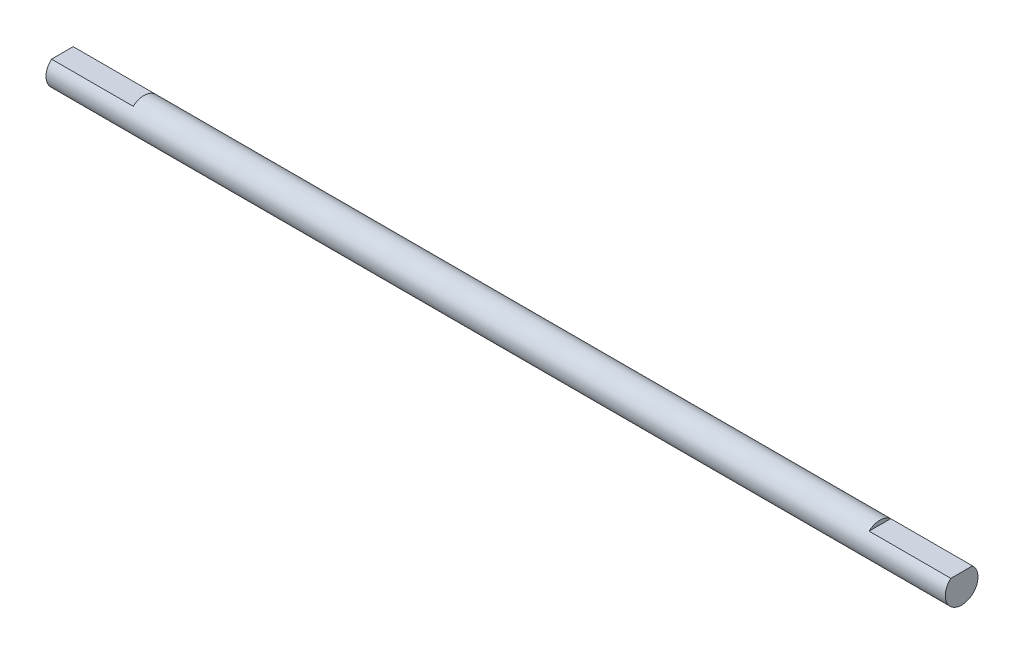
from build123d import *

# Parameters (mm, degrees)
BOSS_EXTRUDE1_DEPTH = 55
SKETCH2_R           = 2
BOSS_EXTRUDE2_DEPTH = 45


with BuildPart() as part:
    # Sketch1 → Boss-Extrude1 (new, symmetric)
    with BuildSketch(Plane(origin=(0, 0, 0), x_dir=(0, 0, -1), z_dir=(1, 0, 0))):
        with BuildLine():
            Line((-1.322875656, 1.5), (1.322875656, 1.5))
            ThreePointArc((1.322875656, 1.5), (0, -2), (-1.322875656, 1.5))
        make_face()
    extrude(amount=BOSS_EXTRUDE1_DEPTH, both=True)

    # Sketch2 → Boss-Extrude2 (add, symmetric)
    with BuildSketch(Plane(origin=(0, 0, 0), x_dir=(0, 0, -1), z_dir=(1, 0, 0))):
        Circle(SKETCH2_R)
    extrude(amount=BOSS_EXTRUDE2_DEPTH, both=True)


solid = part.part
